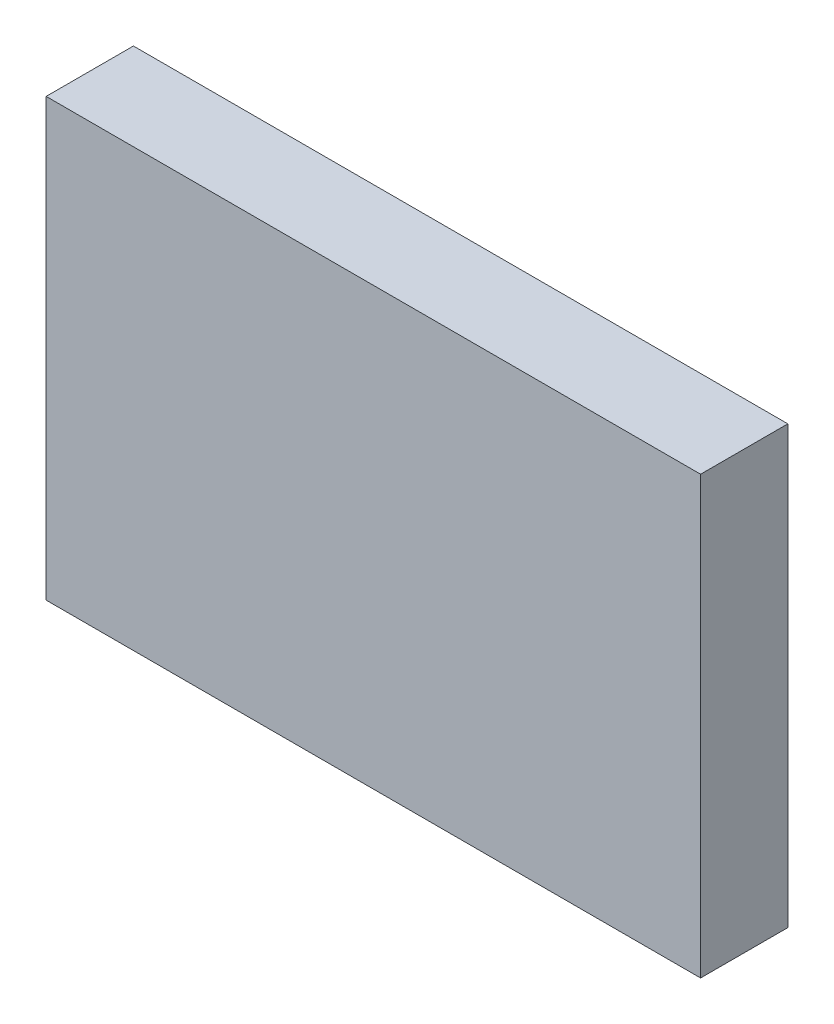
from build123d import *

# Parameters (mm, degrees)
SKETCH_1_W             = 30
SKETCH_1_H             = 20
SM_BASE_FLANGE_1_DEPTH = 4


# Sheet-metal steps are written as plain solids
with BuildPart() as part:
    # Sketch 1 → Базовая кромка1 (new body)
    with BuildSketch(Plane.XY):
        Rectangle(SKETCH_1_W, SKETCH_1_H)
    extrude(amount=-SM_BASE_FLANGE_1_DEPTH)


solid = part.part
